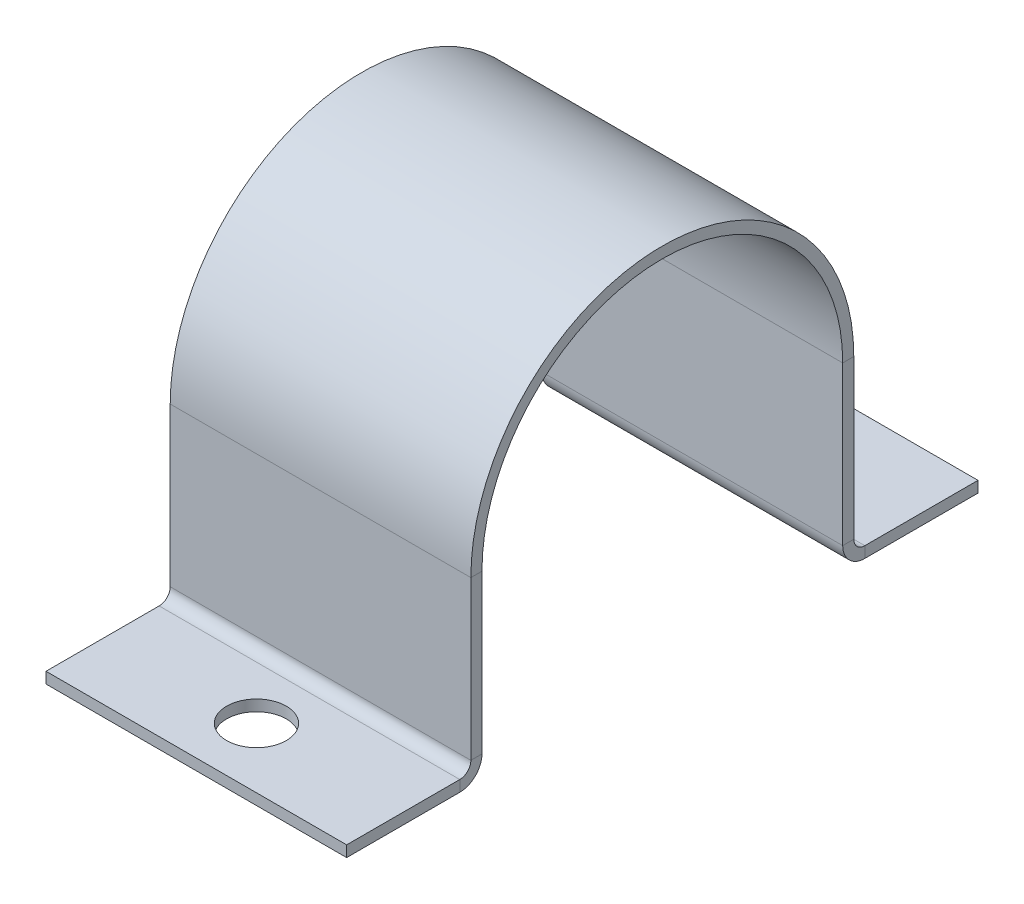
from build123d import *

# Parameters (mm, degrees)
BASE_FLANGE1_DEPTH = 10
SKETCH6_R          = 1.984375
CUT_EXTRUDE1_DEPTH = 34.421549934


# Sheet-metal steps are written as plain solids
with BuildPart() as part:
    # Sketch1 → Base-Flange1 (new, symmetric)
    with BuildSketch(Plane(origin=(0, 0, 0), x_dir=(0, 0, -1), z_dir=(1, 0, 0))):
        with BuildLine():
            Line((-21, 0), (-13.4732, 0))
            ThreePointArc((-13.4732, 0), (-12.43149029, 0.43149029), (-12, 1.4732))
            Line((-12, 1.4732), (-12, 12))
            ThreePointArc((-12, 12), (0, 24), (12, 12))
            Line((12, 12), (12, 1.4732))
            ThreePointArc((12, 1.4732), (12.43149029, 0.43149029), (13.4732, 0))
            Line((13.4732, 0), (21, 0))
            Line((21, 0), (21, 0.7366))
            Line((21, 0.7366), (13.4732, 0.7366))
            ThreePointArc((13.4732, 0.7366), (12.952345145, 0.952345145), (12.7366, 1.4732))
            Line((12.7366, 1.4732), (12.7366, 12))
            ThreePointArc((12.7366, 12), (0, 24.7366), (-12.7366, 12))
            Line((-12.7366, 12), (-12.7366, 1.4732))
            ThreePointArc((-12.7366, 1.4732), (-12.952345145, 0.952345145), (-13.4732, 0.7366))
            Line((-13.4732, 0.7366), (-21, 0.7366))
            Line((-21, 0.7366), (-21, 0))
        make_face()
    extrude(amount=BASE_FLANGE1_DEPTH, both=True)

    # Sketch6 → Cut-Extrude1 (cut, through all)
    with BuildSketch(Plane(origin=(0, 0.7366, 0), x_dir=(1, 0, 0), z_dir=(0, 1, 0))):
        with Locations(Location((0, -17, 0), (0, 0, 270))):
            Circle(SKETCH6_R)
    cut_extrude1 = extrude(amount=-CUT_EXTRUDE1_DEPTH, mode=Mode.SUBTRACT)

    # Mirror1: Cut-Extrude1 across plane
    add(cut_extrude1.mirror(Plane.XY), mode=Mode.SUBTRACT)


solid = part.part
